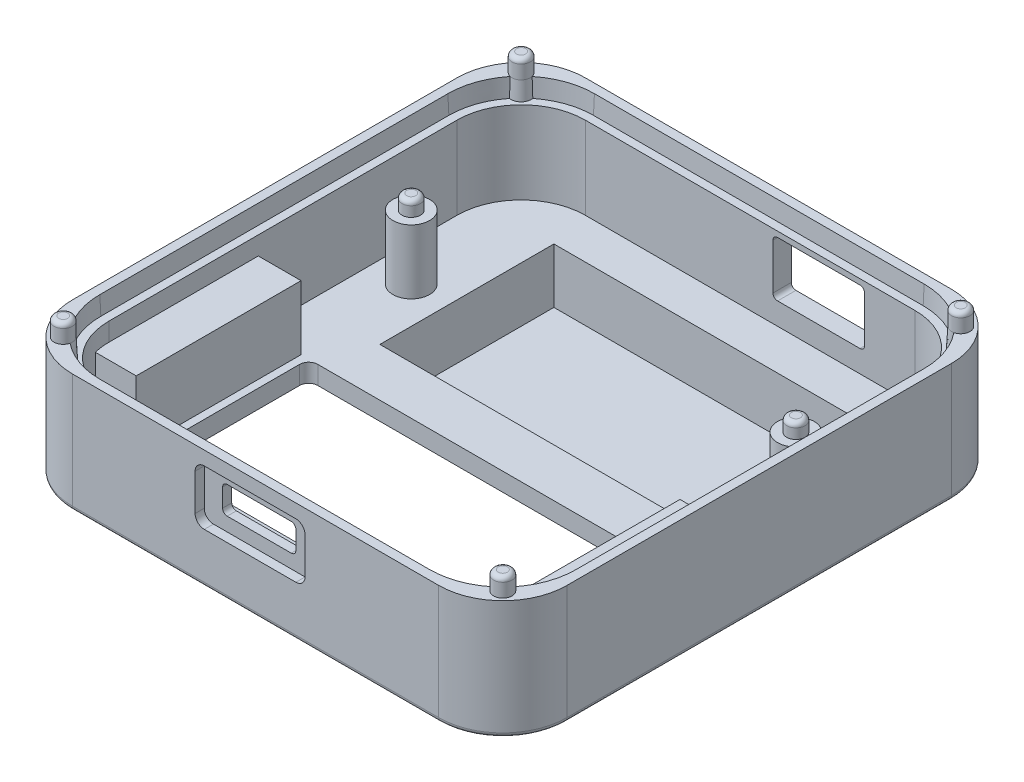
from build123d import *

# Parameters (mm, degrees)
SKETCH1_W                = 54
SKETCH1_H                = 56.00000000000001
BOSS_EXTRUDE1_DEPTH      = 13
CUT_EXTRUDE1_DEPTH       = 11
SKETCH30_R               = 1.0000000000000018
BOSS_EXTRUDE2_DEPTH      = 8.6
CUT_EXTRUDE2_DEPTH       = 10
FILLET2_R                = 7
FILLET3_R                = 7
FILLET4_R                = 7
SKETCH33_W               = 7.999999999999999
SKETCH33_H               = 2.9999999999999973
CUT_EXTRUDE3_DEPTH       = 10
CUT_EXTRUDE9_DEPTH       = 2
FILLET6_R                = 0.5
SKETCH45_R               = 1.0000000000000018
BOSS_EXTRUDE4_DEPTH      = 2
FILLET8_R                = 0.5
FILLET9_R                = 1
FILLET10_R               = 0.5
FILLET11_R               = 0.5
LIP_GROOVE1_GROOVE_DEPTH = 2
LIP_GROOVE1_GROOVE_DRAFT = -3
FILLET12_R               = 0.5
SKETCH47_R               = 1.9999999999999996
BOSS_EXTRUDE5_DEPTH      = 7
BOSS_EXTRUDE7_DEPTH      = 5
CUT_EXTRUDE10_DEPTH      = 6
FILLET14_R               = 1
FILLET15_R               = 1
SKETCH51_W               = 4.668214643890426
SKETCH51_H               = 18
SKETCH51_W_2             = 3.958751602538854
BOSS_EXTRUDE8_DEPTH      = 7
CUT_EXTRUDE11_DEPTH      = 1
FILLET16_R               = 1


# Read off the part's stored shape, not the designer's step: Lip&Groove1-Groove
with BuildPart() as part:
    # Sketch1 → Boss-Extrude1 (new body)
    with BuildSketch(Plane(origin=(0, 0, 0), x_dir=(1, 0, 0), z_dir=(0, 1, 0))):
        Rectangle(SKETCH1_W, SKETCH1_H)
    extrude(amount=BOSS_EXTRUDE1_DEPTH)

    # 3DSketch1 → Cut-Extrude1 (cut)
    with BuildSketch(Plane(origin=(24.999999999999986, 13, -26.000000000000018), x_dir=(-0.6931087162517843, 0, 0.7208330649018562), z_dir=(0, -1, 0))):
        Polygon((0, 0), (34.65543581258921, 36.041653245092796), (72.13875518748574, 0), (37.48331937489653, -36.041653245092796), align=None)
    extrude(amount=CUT_EXTRUDE1_DEPTH, mode=Mode.SUBTRACT)

    # Sketch30 → Boss-Extrude2 (add)
    with BuildSketch(Plane(origin=(0, 2.0000000000000018, 0), x_dir=(1, 0, 0), z_dir=(0, 1, 0))):
        with Locations(Location((21.000000000000007, 10.000000000000002, 0), (0, 0, 90))):
            Circle(SKETCH30_R)
        with Locations(Location((-21.000000000000014, 10.000000000000002, 0), (0, 0, 90))):
            Circle(SKETCH30_R)
    extrude(amount=BOSS_EXTRUDE2_DEPTH)

    # Sketch32 → Cut-Extrude2 (cut)
    with BuildSketch(Plane(origin=(0, 0, 0), x_dir=(-1, 0, 0), z_dir=(0, -1, 0))):
        Polygon((19.500000000000025, -20.700000000000006), (-19.499999999999975, -20.700000000000006), (-19.499999999999975, -2.700000000000008), (19.500000000000025, -2.7000000000000046), align=None)
    extrude(amount=-CUT_EXTRUDE2_DEPTH, mode=Mode.SUBTRACT)

    # Fillet2
    fillet2_edges = [part.edges().sort_by_distance(p)[0] for p in [
        (-25, 7.5, 26.000000000000004),
    ]]
    fillet(fillet2_edges, radius=FILLET2_R)

    # Fillet3
    fillet3_edges = [part.edges().sort_by_distance(p)[0] for p in [
        (24.999999999999986, 7.5, -26.000000000000018),
        (-25, 7.5, -26.00000000000001),
        (24.99999999999999, 7.5, 25.999999999999996),
    ]]
    fillet(fillet3_edges, radius=FILLET3_R)

    # Fillet4
    fillet4_edges = [part.edges().sort_by_distance(p)[0] for p in [
        (-27.000000000000004, 6.5, 28),
        (-27.000000000000004, 6.5, -28),
        (26.999999999999996, 6.5, -28),
        (26.999999999999996, 6.5, 28),
    ]]
    fillet(fillet4_edges, radius=FILLET4_R)

    # Sketch33 → Cut-Extrude3 (cut)
    with BuildSketch(Plane.XY.offset(28)):
        with Locations((-0.6000000000000001, 8.5)):
            Rectangle(SKETCH33_W, SKETCH33_H)
    extrude(amount=-CUT_EXTRUDE3_DEPTH, mode=Mode.SUBTRACT)

    # Sketch42 → Cut-Extrude9 (cut)
    with BuildSketch(Plane(origin=(0, 0, -28), x_dir=(-1, 0, 0), z_dir=(0, 0, -1))):
        Polygon((-2.499999999999998, 10.4), (-12.499999999999998, 10.399999999999999), (-12.499999999999996, 4.399999999999999), (-2.4999999999999973, 4.3999999999999995), align=None)
    extrude(amount=-CUT_EXTRUDE9_DEPTH, mode=Mode.SUBTRACT)

    # Fillet6
    fillet6_edges = [part.edges().sort_by_distance(p)[0] for p in [
        (26.999999999999996, 0, 0),
        (-3.55e-15, 0, 28),
        (-27.000000000000004, 0, 0),
        (-3.55e-15, 0, -28),
        (-24.949747468305837, 0, 25.949747468305834),
        (-24.949747468305837, 0, -25.94974746830583),
        (24.94974746830583, 0, -25.94974746830583),
        (24.94974746830583, 0, 25.949747468305834),
    ]]
    fillet(fillet6_edges, radius=FILLET6_R)

    # Sketch45 → Boss-Extrude4 (add)
    with BuildSketch(Plane(origin=(0, 13, 0), x_dir=(1, 0, 0), z_dir=(0, 1, 0))):
        with Locations(Location((23.999999999999996, -25, 0), (0, 0, 270))):
            Circle(SKETCH45_R)
        with Locations(Location((-24.000000000000004, -25, 0), (0, 0, 270))):
            Circle(SKETCH45_R)
        with Locations(Location((-24.000000000000004, 24.999999999999996, 0), (0, 0, 270))):
            Circle(SKETCH45_R)
        with Locations(Location((23.999999999999993, 25, 0), (0, 0, 270))):
            Circle(SKETCH45_R)
    extrude(amount=BOSS_EXTRUDE4_DEPTH)

    # Fillet8
    fillet8_edges = [part.edges().sort_by_distance(p)[0] for p in [
        (23.999999999999996, 15, 24),
        (-24.000000000000004, 15, 24),
        (-24.000000000000004, 15, -26),
        (23.999999999999993, 15, -26),
    ]]
    fillet(fillet8_edges, radius=FILLET8_R)

    # Fillet9
    fillet9_edges = [part.edges().sort_by_distance(p)[0] for p in [
        (19.499999999999975, 1, 20.700000000000006),
        (19.499999999999975, 1, 2.700000000000008),
        (-19.500000000000025, 1, 2.7000000000000046),
        (-19.500000000000025, 1, 20.700000000000006),
    ]]
    fillet(fillet9_edges, radius=FILLET9_R)

    # Fillet10
    fillet10_edges = [part.edges().sort_by_distance(p)[0] for p in [
        (12.499999999999996, 4.399999999999999, -27),
        (12.499999999999998, 10.399999999999999, -27),
        (2.499999999999998, 10.4, -27),
        (2.4999999999999973, 4.3999999999999995, -27),
    ]]
    fillet(fillet10_edges, radius=FILLET10_R)

    # Fillet11
    fillet11_edges = [part.edges().sort_by_distance(p)[0] for p in [
        (3.4, 9.999999999999998, 27),
        (3.4, 7, 27),
        (-4.6, 7, 27),
        (-4.6, 9.999999999999998, 27),
    ]]
    fillet(fillet11_edges, radius=FILLET11_R)


with BuildPart() as lip_groove1_groove_tool:
    # Lip&Groove1-Groove outline → Lip&Groove1-Groove (with draft: the straight prism first)
    with BuildSketch(Plane(origin=(0, 11, 0), x_dir=(1, 0, 0), z_dir=(0, 1, 0))):
        with BuildLine():
            ThreePointArc((-22.910349682, 25.18242698), (-23.218777427, 24.218777427), (-24.18242698, 23.910349682))
            ThreePointArc((-24.18242698, 23.910349682), (-25.454707864, 21.600243841), (-25.895184441, 19))
            Line((-25.895184441, 19), (-25.895184441, -19))
            ThreePointArc((-25.895184441, -19), (-25.454707864, -21.600243841), (-24.18242698, -23.910349682))
            ThreePointArc((-24.18242698, -23.910349682), (-23.218777427, -24.218777427), (-22.910349682, -25.18242698))
            ThreePointArc((-22.910349682, -25.18242698), (-20.600243841, -26.454707864), (-18, -26.895184441))
            Line((-18, -26.895184441), (18, -26.895184441))
            ThreePointArc((18, -26.895184441), (20.600243841, -26.454707864), (22.910349682, -25.18242698))
            ThreePointArc((22.910349682, -25.18242698), (23.218777427, -24.218777427), (24.18242698, -23.910349682))
            ThreePointArc((24.18242698, -23.910349682), (25.454707864, -21.600243841), (25.895184441, -19))
            Line((25.895184441, -19), (25.895184441, 19))
            ThreePointArc((25.895184441, 19), (25.454707864, 21.600243841), (24.18242698, 23.910349682))
            ThreePointArc((24.18242698, 23.910349682), (23.218777427, 24.218777427), (22.910349682, 25.18242698))
            ThreePointArc((22.910349682, 25.18242698), (20.600243841, 26.454707864), (18, 26.895184441))
            Line((18, 26.895184441), (-18, 26.895184441))
            ThreePointArc((-18, 26.895184441), (-20.600243841, 26.454707864), (-22.910349682, 25.18242698))
        make_face()
        with BuildLine():
            ThreePointArc((-25, 19), (-22.949747468, 23.949747468), (-18, 26))
            Line((-18, 26), (18, 26))
            ThreePointArc((18, 26), (22.949747468, 23.949747468), (25, 19))
            Line((25, 19), (25, -19))
            ThreePointArc((25, -19), (22.949747468, -23.949747468), (18, -26))
            Line((18, -26), (-18, -26))
            ThreePointArc((-18, -26), (-22.949747468, -23.949747468), (-25, -19))
            Line((-25, -19), (-25, 19))
        make_face(mode=Mode.SUBTRACT)
    extrude(amount=LIP_GROOVE1_GROOVE_DEPTH)
    # Lip&Groove1-Groove: the draft: its side faces are tilted about the plane it starts from
    lip_groove1_groove_sides = [lip_groove1_groove_tool.faces().sort_by_distance(p)[0] for p in [
        (-23.218777427, 12, -24.218777427),
        (-25.454707864, 12, -21.600243841),
        (-25.895184441, 12, 0),
        (-25.454707864, 12, 21.600243841),
        (-23.218777427, 12, 24.218777427),
        (-20.600243841, 12, 26.454707864),
        (0, 12, 26.895184441),
        (20.600243841, 12, 26.454707864),
        (23.218777427, 12, 24.218777427),
        (25.454707864, 12, 21.600243841),
        (25.895184441, 12, 0),
        (25.454707864, 12, -21.600243841),
        (23.218777427, 12, -24.218777427),
        (20.600243841, 12, -26.454707864),
        (0, 12, -26.895184441),
        (-20.600243841, 12, -26.454707864),
        (-22.949747468, 12, -23.949747468),
        (0, 12, -26),
        (22.949747468, 12, -23.949747468),
        (25, 12, 0),
        (22.949747468, 12, 23.949747468),
        (0, 12, 26),
        (-22.949747468, 12, 23.949747468),
        (-25, 12, 0),
    ]]
    draft(lip_groove1_groove_sides, Plane(origin=(0, 11, 0), x_dir=(1, 0, 0), z_dir=(0, 1, 0)), LIP_GROOVE1_GROOVE_DRAFT)


with BuildPart() as part_1:
    add(part.part)

    # Lip&Groove1-Groove: cut by lip_groove1_groove_tool
    add(lip_groove1_groove_tool.part, mode=Mode.SUBTRACT)

    # Fillet12
    fillet12_edges = [part_1.edges().sort_by_distance(p)[0] for p in [
        (21.000000000000007, 10.600000000000001, -9),
        (-21.000000000000014, 10.600000000000001, -9),
    ]]
    fillet(fillet12_edges, radius=FILLET12_R)

    # Sketch47 → Boss-Extrude5 (add)
    with BuildSketch(Plane(origin=(0, 2.0000000000000018, 0), x_dir=(1, 0, 0), z_dir=(0, 1, 0))):
        with Locations(Location((21.000000000000007, 10.000000000000002, 0), (0, 0, 270))):
            Circle(SKETCH47_R)
        with Locations(Location((-21.000000000000014, 10.000000000000002, 0), (0, 0, 270))):
            Circle(SKETCH47_R)
    extrude(amount=BOSS_EXTRUDE5_DEPTH)

    # Sketch49 → Boss-Extrude7 (add)
    with BuildSketch(Plane(origin=(0, 0, 0), x_dir=(-1, 0, 0), z_dir=(0, -1, 0))):
        Polygon((17.499999999999996, 22.075207643153902), (-17.500000000000004, 22.075207643153888), (-17.500000000000004, 2.0752076431538886), (17.500000000000004, 2.0752076431538993), align=None)
    extrude(amount=BOSS_EXTRUDE7_DEPTH)

    # Sketch50 → Cut-Extrude10 (cut)
    with BuildSketch(Plane(origin=(0, 2.0000000000000018, 0), x_dir=(1, 0, 0), z_dir=(0, 1, 0))):
        Polygon((16.999999999999996, 21.5752076431539), (-17.000000000000004, 21.575207643153902), (-17.000000000000004, 2.5752076431538975), (16.999999999999996, 2.5752076431539046), align=None)
    extrude(amount=-CUT_EXTRUDE10_DEPTH, mode=Mode.SUBTRACT)

    # Fillet14
    fillet14_edges = [part_1.edges().sort_by_distance(p)[0] for p in [
        (17.500000000000004, -5, -12.075207643153888),
        (0, -5, -2.075207643153894),
        (-17.5, -5, -12.0752076431539),
        (3.55e-15, -5, -22.075207643153895),
    ]]
    fillet(fillet14_edges, radius=FILLET14_R)

    # Fillet15
    # the kernel refuses this fillet: 1 mm, written as the material it takes off along each edge
    with BuildSketch(Plane(origin=(-16.500000000000004, -4, -3.075207643153899), x_dir=(-3e-16, 0, 1), z_dir=(-1, 0, -3.6e-16))) as fillet15_piece_1_section:
        Polygon((0, 0), (FILLET15_R, 0), (FILLET15_R, -FILLET15_R), (0, -FILLET15_R), align=None)
    fillet15_piece_1 = extrude(amount=FILLET15_R, mode=Mode.PRIVATE)
    fillet15_piece_1 = fillet15_piece_1 - Plane(origin=(-16.500000000000004, -4, -3.075207643153899), x_dir=(0, 0.7071067811865475, -0.7071067811865475), z_dir=(-1, 0, -3.6e-16)) * Sphere(FILLET15_R, mode=Mode.PRIVATE)
    add(fillet15_piece_1, mode=Mode.SUBTRACT)
    with BuildSketch(Plane(origin=(16.500000000000004, -4, -3.075207643153889), x_dir=(1, 0, 0), z_dir=(-3e-16, 0, 1))) as fillet15_piece_2_section:
        Polygon((0, 0), (FILLET15_R, 0), (FILLET15_R, -FILLET15_R), (0, -FILLET15_R), align=None)
    fillet15_piece_2 = extrude(amount=FILLET15_R, mode=Mode.PRIVATE)
    fillet15_piece_2 = fillet15_piece_2 - Plane(origin=(16.500000000000004, -4, -3.075207643153889), x_dir=(-0.7071067811865475, 0.7071067811865475, 0), z_dir=(-3e-16, 0, 1)) * Sphere(FILLET15_R, mode=Mode.PRIVATE)
    add(fillet15_piece_2, mode=Mode.SUBTRACT)
    with BuildSketch(Plane(origin=(-16.499999999999996, -4, -21.075207643153902), x_dir=(4.1e-16, 0, -1), z_dir=(-1, 0, -3.6e-16))) as fillet15_piece_3_section:
        Polygon((0, 0), (FILLET15_R, 0), (FILLET15_R, FILLET15_R), (0, FILLET15_R), align=None)
    fillet15_piece_3 = extrude(amount=FILLET15_R, mode=Mode.PRIVATE)
    fillet15_piece_3 = fillet15_piece_3 - Plane(origin=(-16.499999999999996, -4, -21.075207643153902), x_dir=(0, 0.7071067811865475, 0.7071067811865475), z_dir=(-1, 0, -3.6e-16)) * Sphere(FILLET15_R, mode=Mode.PRIVATE)
    add(fillet15_piece_3, mode=Mode.SUBTRACT)
    with BuildSketch(Plane(origin=(16.500000000000004, -4, -21.075207643153888), x_dir=(1, 0, 0), z_dir=(4.1e-16, 0, -1))) as fillet15_piece_4_section:
        Polygon((0, 0), (FILLET15_R, 0), (FILLET15_R, FILLET15_R), (0, FILLET15_R), align=None)
    fillet15_piece_4 = extrude(amount=FILLET15_R, mode=Mode.PRIVATE)
    fillet15_piece_4 = fillet15_piece_4 - Plane(origin=(16.500000000000004, -4, -21.075207643153888), x_dir=(-0.7071067811865475, 0.7071067811865475, 0), z_dir=(4.1e-16, 0, -1)) * Sphere(FILLET15_R, mode=Mode.PRIVATE)
    add(fillet15_piece_4, mode=Mode.SUBTRACT)
    with BuildSketch(Plane(origin=(17.500000000000004, 0, -22.075207643153888), x_dir=(-1, 0, 0), z_dir=(0, -1, 0)), Plane(origin=(-17.499999999999996, 0, -22.075207643153902), x_dir=(0, 0, 1), z_dir=(0, -1, 0))) as fillet15_piece_5:
        with BuildLine():
            CenterArc((FILLET15_R, -FILLET15_R), FILLET15_R, 90, 90)
            Line((0, -FILLET15_R), (0, 0))
            Line((0, 0), (FILLET15_R, 0))
        make_face()
    extrude(amount=4, mode=Mode.SUBTRACT)
    with BuildSketch(Plane(origin=(-17.500000000000004, 0, -2.0752076431538993), x_dir=(0, 0, -1), z_dir=(0, -1, 0))) as fillet15_piece_6:
        with BuildLine():
            CenterArc((FILLET15_R, FILLET15_R), FILLET15_R, 180, 90)
            Line((0, FILLET15_R), (0, 0))
            Line((0, 0), (FILLET15_R, 0))
        make_face()
    extrude(amount=4, mode=Mode.SUBTRACT)
    with BuildSketch(Plane(origin=(17.500000000000004, 0, -2.0752076431538886), x_dir=(-1, 0, -4.4e-16), z_dir=(0, -1, 0))) as fillet15_piece_7:
        with BuildLine():
            CenterArc((FILLET15_R, FILLET15_R), FILLET15_R, 180.00000000000003, 89.99999999999994)
            Line((4.4e-16, FILLET15_R), (0, 0))
            Line((0, 0), (FILLET15_R, 0))
        make_face()
    extrude(amount=4, mode=Mode.SUBTRACT)

    # Sketch51 → Boss-Extrude8 (add)
    with BuildSketch(Plane(origin=(0, 2.0000000000000018, 0), x_dir=(1, 0, 0), z_dir=(0, 1, 0))):
        with Locations((-22.66589267805479, -11.700000000000006)):
            Rectangle(SKETCH51_W, SKETCH51_H)
        with Locations((23.02062419873056, -11.700000000000006)):
            Rectangle(SKETCH51_W_2, SKETCH51_H)
    extrude(amount=BOSS_EXTRUDE8_DEPTH)

    # Sketch52 → Cut-Extrude11 (cut)
    with BuildSketch(Plane.XY.offset(28)):
        Polygon((-6.6, 11.499999999999998), (5.4, 11.499999999999998), (5.400000000000001, 5.5), (-6.599999999999999, 5.5), align=None)
    extrude(amount=-CUT_EXTRUDE11_DEPTH, mode=Mode.SUBTRACT)

    # Fillet16
    fillet16_edges = [part_1.edges().sort_by_distance(p)[0] for p in [
        (-6.599999999999999, 5.5, 27.5),
        (-6.6, 11.499999999999998, 27.5),
        (5.4, 11.499999999999998, 27.5),
        (5.400000000000001, 5.5, 27.5),
    ]]
    fillet(fillet16_edges, radius=FILLET16_R)


solid = part_1.part
